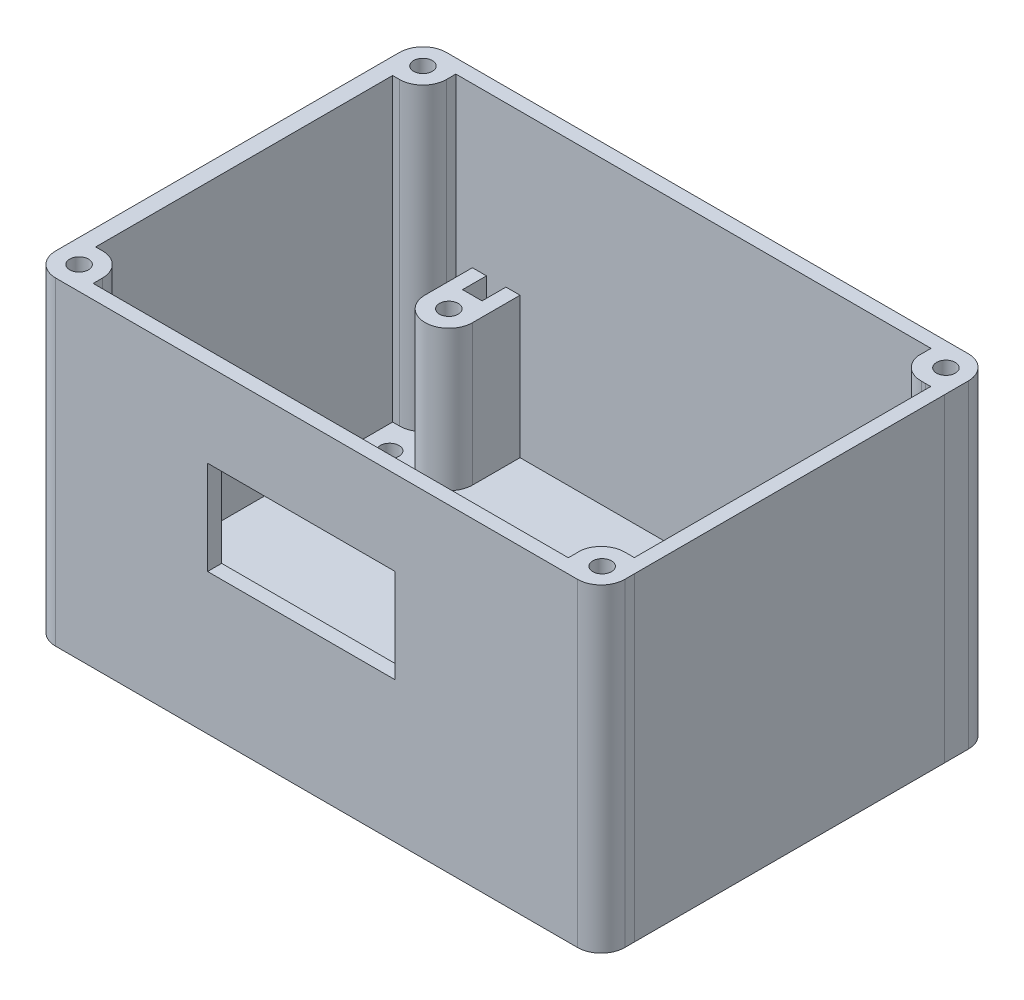
from build123d import *

# Parameters (mm, degrees)
BOSS_EXTRUDE2_DEPTH  = 32
SKETCH1_5_R          = 1
BOSS_EXTRUDE3_DEPTH  = 15
SKETCH3_W            = 59.66
SKETCH3_H            = 41.66
BOSS_EXTRUDE12_DEPTH = 2
SKETCH4_W            = 38.735
SKETCH4_H            = 2
CUT_EXTRUDE1_DEPTH   = 15
SKETCH5_W            = 5
SKETCH5_H            = 2
CUT_EXTRUDE2_DEPTH   = 15
SKETCH6_W            = 2
SKETCH6_H            = 2
CUT_EXTRUDE3_DEPTH   = 15
SKETCH7_W            = 5
SKETCH7_H            = 2
CUT_EXTRUDE4_DEPTH   = 15
SKETCH8_W            = 2
SKETCH8_H            = 2
CUT_EXTRUDE5_DEPTH   = 15
SKETCH9_W            = 38.735
SKETCH9_H            = 2
CUT_EXTRUDE6_DEPTH   = 15
SKETCH10_W           = 20
SKETCH10_H           = 10
CUT_EXTRUDE7_DEPTH   = 15
SKETCH11_W           = 5
SKETCH11_H           = 5
BOSS_EXTRUDE13_DEPTH = 32
CUT_EXTRUDE8_DEPTH   = 10
SKETCH13_W           = 5
SKETCH13_H           = 5
BOSS_EXTRUDE14_DEPTH = 32
SKETCH14_W           = 5
SKETCH14_H           = 5
BOSS_EXTRUDE15_DEPTH = 32
SKETCH15_W           = 5
SKETCH15_H           = 5
BOSS_EXTRUDE16_DEPTH = 32
CUT_EXTRUDE9_DEPTH   = 10
CUT_EXTRUDE10_DEPTH  = 10
CUT_EXTRUDE11_DEPTH  = 10
CUT_EXTRUDE12_DEPTH  = 17
CUT_EXTRUDE13_DEPTH  = 17
CUT_EXTRUDE14_DEPTH  = 47
CUT_EXTRUDE15_DEPTH  = 47
CUT_EXTRUDE16_DEPTH  = 47
CUT_EXTRUDE17_DEPTH  = 47
BOSS_EXTRUDE18_DEPTH = 27
CUT_EXTRUDE19_DEPTH  = 32
CUT_EXTRUDE20_DEPTH  = 32
CUT_EXTRUDE28_DEPTH  = 15
CUT_EXTRUDE29_DEPTH  = 17
BOSS_EXTRUDE24_DEPTH = 15
BOSS_EXTRUDE25_DEPTH = 17
BOSS_EXTRUDE26_DEPTH = 17
SKETCH45_W           = 6
SKETCH45_H           = 43.66
BOSS_EXTRUDE27_DEPTH = 34
SKETCH46_W           = 6
SKETCH46_H           = 2
CUT_EXTRUDE30_DEPTH  = 34
SKETCH47_W           = 2.5
SKETCH47_H           = 0.998333333
CUT_EXTRUDE31_DEPTH  = 17
CUT_EXTRUDE33_DEPTH  = 37
CUT_EXTRUDE34_DEPTH  = 32
BOSS_EXTRUDE28_DEPTH = 34
SKETCH53_W           = 1.000110953
SKETCH53_H           = 33.096
CUT_EXTRUDE35_DEPTH  = 34
SKETCH54_R           = 1
CUT_EXTRUDE36_DEPTH  = 10
SKETCH55_R           = 1.016
CUT_EXTRUDE37_DEPTH  = 10
CUT_EXTRUDE38_DEPTH  = 17
CUT_EXTRUDE41_DEPTH  = 15
CUT_EXTRUDE42_DEPTH  = 15
CUT_EXTRUDE43_DEPTH  = 15
CUT_EXTRUDE44_DEPTH  = 15
SKETCH65_R           = 1.016
BOSS_EXTRUDE29_DEPTH = 15
SKETCH66_R           = 1
CUT_EXTRUDE45_DEPTH  = 10
CUT_EXTRUDE47_DEPTH  = 15
CUT_EXTRUDE48_DEPTH  = 15
CUT_EXTRUDE49_DEPTH  = 15
CUT_EXTRUDE50_DEPTH  = 15
SKETCH72_R           = 1
CUT_EXTRUDE51_DEPTH  = 10
SKETCH73_W           = 50.66
SKETCH73_H           = 0.51
CUT_EXTRUDE52_DEPTH  = 32
SKETCH74_W           = 1.5
SKETCH74_H           = 0.51
BOSS_EXTRUDE30_DEPTH = 15
SKETCH75_W           = 1.5
SKETCH75_H           = 0.51
BOSS_EXTRUDE31_DEPTH = 15
SKETCH76_W           = 1.5
SKETCH76_H           = 0.51
BOSS_EXTRUDE32_DEPTH = 15
SKETCH77_W           = 1.5
SKETCH77_H           = 0.51
BOSS_EXTRUDE33_DEPTH = 15
SKETCH78_W           = 50.66
SKETCH78_H           = 0.5
CUT_EXTRUDE53_DEPTH  = 32
SKETCH79_W           = 1.5
SKETCH79_H           = 0.5
BOSS_EXTRUDE34_DEPTH = 15
SKETCH80_W           = 1.5
SKETCH80_H           = 0.5
BOSS_EXTRUDE35_DEPTH = 15
SKETCH81_W           = 1.5
SKETCH81_H           = 0.5
BOSS_EXTRUDE36_DEPTH = 15
SKETCH82_W           = 1.5
SKETCH82_H           = 0.5
BOSS_EXTRUDE37_DEPTH = 15
CUT_EXTRUDE54_DEPTH  = 32
BOSS_EXTRUDE40_DEPTH = 32
BOSS_EXTRUDE41_DEPTH = 34
SKETCH87_W           = 0.841153112
SKETCH87_H           = 0.19310663
BOSS_EXTRUDE42_DEPTH = 2
SKETCH88_W           = 1.922760296
SKETCH88_H           = 1.416
BOSS_EXTRUDE44_DEPTH = 17
BOSS_EXTRUDE46_DEPTH = 17
BOSS_EXTRUDE47_DEPTH = 17


with BuildPart() as part:
    # Sketch1 → Boss-Extrude2 (new body)
    with BuildSketch(Plane(origin=(0, 0, 0), x_dir=(1, 0, 0), z_dir=(0, 1, 0))):
        Polygon((50.355, -6.54), (50.355, -4.54), (50.355, 35.12), (-9.305, 35.12), (-9.305, -6.54), align=None)
        Polygon((48.355, 31.115), (48.355, -2.54), (48.355, -4.54), (-7.54, -4.54), (-7.54, -2.54), (-7.54, 31.115), (-7.54, 33.115), (48.355, 33.115), align=None, mode=Mode.SUBTRACT)
    extrude(amount=BOSS_EXTRUDE2_DEPTH)

    # Sketch1<5> → Boss-Extrude3 (add)
    # profile 1 of 2: a face of its own
    with BuildSketch(Plane(origin=(0, 0, 0), x_dir=(1, 0, 0), z_dir=(0, 1, 0))):
        Polygon((46.355, 2.54), (41.275, 2.54), (41.275, -2.54), (2.54, -2.54), (2.54, 2.54), (-2.54, 2.54), (-2.54, -2.54), (-7.54, -2.54), (-7.54, -4.54), (48.355, -4.54), (48.355, -2.54), (46.355, -2.54), align=None)
        with Locations((43.815, 0)):
            Circle(SKETCH1_5_R, mode=Mode.SUBTRACT)
        Circle(SKETCH1_5_R, mode=Mode.SUBTRACT)
    # profile 2 of 2: a face of its own
    with BuildSketch(Plane(origin=(0, 0, 0), x_dir=(1, 0, 0), z_dir=(0, 1, 0))):
        Polygon((41.275, 26.035), (46.355, 26.035), (46.355, 31.115), (48.355, 31.115), (48.355, 33.115), (-7.54, 33.115), (-7.54, 31.115), (-2.54, 31.115), (-2.54, 26.035), (2.54, 26.035), (2.54, 31.115), (41.275, 31.115), align=None)
        with Locations((43.815, 28.575)):
            Circle(SKETCH1_5_R, mode=Mode.SUBTRACT)
        with Locations((0, 28.575)):
            Circle(SKETCH1_5_R, mode=Mode.SUBTRACT)
    extrude(amount=BOSS_EXTRUDE3_DEPTH)

    # Sketch3 → Boss-Extrude12 (add)
    with BuildSketch(Plane(origin=(0, 0, 0), x_dir=(-1, 0, 0), z_dir=(0, -1, 0))):
        with Locations((-20.525, 14.29)):
            Rectangle(SKETCH3_W, SKETCH3_H)
    extrude(amount=BOSS_EXTRUDE12_DEPTH)

    # Sketch4 → Cut-Extrude1 (cut)
    with BuildSketch(Plane(origin=(0, 15, 0), x_dir=(1, 0, 0), z_dir=(0, 1, 0))):
        with Locations((21.9075, 32.115)):
            Rectangle(SKETCH4_W, SKETCH4_H)
    extrude(amount=-CUT_EXTRUDE1_DEPTH, mode=Mode.SUBTRACT)

    # Sketch5 → Cut-Extrude2 (cut)
    with BuildSketch(Plane(origin=(0, 15, 0), x_dir=(1, 0, 0), z_dir=(0, 1, 0))):
        with Locations((-5.04, 32.115)):
            Rectangle(SKETCH5_W, SKETCH5_H)
    extrude(amount=-CUT_EXTRUDE2_DEPTH, mode=Mode.SUBTRACT)

    # Sketch6 → Cut-Extrude3 (cut)
    with BuildSketch(Plane(origin=(0, 15, 0), x_dir=(1, 0, 0), z_dir=(0, 1, 0))):
        with Locations((47.355, 32.115)):
            Rectangle(SKETCH6_W, SKETCH6_H)
    extrude(amount=-CUT_EXTRUDE3_DEPTH, mode=Mode.SUBTRACT)

    # Sketch7 → Cut-Extrude4 (cut)
    with BuildSketch(Plane(origin=(0, 15, 0), x_dir=(1, 0, 0), z_dir=(0, 1, 0))):
        with Locations((-5.04, -3.54)):
            Rectangle(SKETCH7_W, SKETCH7_H)
    extrude(amount=-CUT_EXTRUDE4_DEPTH, mode=Mode.SUBTRACT)

    # Sketch8 → Cut-Extrude5 (cut)
    with BuildSketch(Plane(origin=(0, 15, 0), x_dir=(1, 0, 0), z_dir=(0, 1, 0))):
        with Locations((47.355, -3.54)):
            Rectangle(SKETCH8_W, SKETCH8_H)
    extrude(amount=-CUT_EXTRUDE5_DEPTH, mode=Mode.SUBTRACT)

    # Sketch9 → Cut-Extrude6 (cut)
    with BuildSketch(Plane(origin=(0, 15, 0), x_dir=(1, 0, 0), z_dir=(0, 1, 0))):
        with Locations((21.9075, -3.54)):
            Rectangle(SKETCH9_W, SKETCH9_H)
    extrude(amount=-CUT_EXTRUDE6_DEPTH, mode=Mode.SUBTRACT)

    # Sketch10 → Cut-Extrude7 (cut)
    with BuildSketch(Plane.XY.offset(6.54)):
        with Locations((19.395, 18)):
            Rectangle(SKETCH10_W, SKETCH10_H)
    extrude(amount=-CUT_EXTRUDE7_DEPTH, mode=Mode.SUBTRACT)

    # Sketch11 → Boss-Extrude13 (add)
    with BuildSketch(Plane(origin=(0, 32, 0), x_dir=(1, 0, 0), z_dir=(0, 1, 0))):
        with Locations((-6.805, 32.62)):
            Rectangle(SKETCH11_W, SKETCH11_H)
    extrude(amount=-BOSS_EXTRUDE13_DEPTH)

    # Sketch12 → Cut-Extrude8 (cut)
    with BuildSketch(Plane(origin=(0, 32, 0), x_dir=(1, 0, 0), z_dir=(0, 1, 0))):
        with BuildLine():
            ThreePointArc((-7.805, 32.62), (-6.805, 31.62), (-5.805, 32.62))
            ThreePointArc((-5.805, 32.62), (-6.805, 33.62), (-7.805, 32.62))
        make_face()
    extrude(amount=-CUT_EXTRUDE8_DEPTH, mode=Mode.SUBTRACT)

    # Sketch13 → Boss-Extrude14 (add)
    with BuildSketch(Plane(origin=(0, 32, 0), x_dir=(1, 0, 0), z_dir=(0, 1, 0))):
        with Locations((-6.805, -4.04)):
            Rectangle(SKETCH13_W, SKETCH13_H)
    extrude(amount=-BOSS_EXTRUDE14_DEPTH)

    # Sketch14 → Boss-Extrude15 (add)
    with BuildSketch(Plane(origin=(0, 32, 0), x_dir=(1, 0, 0), z_dir=(0, 1, 0))):
        with Locations((47.855, 32.62)):
            Rectangle(SKETCH14_W, SKETCH14_H)
    extrude(amount=-BOSS_EXTRUDE15_DEPTH)

    # Sketch15 → Boss-Extrude16 (add)
    with BuildSketch(Plane(origin=(0, 32, 0), x_dir=(1, 0, 0), z_dir=(0, 1, 0))):
        with Locations((47.855, -4.04)):
            Rectangle(SKETCH15_W, SKETCH15_H)
    extrude(amount=-BOSS_EXTRUDE16_DEPTH)

    # Sketch16 → Cut-Extrude9 (cut)
    with BuildSketch(Plane(origin=(0, 32, 0), x_dir=(1, 0, 0), z_dir=(0, 1, 0))):
        with BuildLine():
            ThreePointArc((47.855, 33.632), (47.139407937, 31.904407937), (48.867, 32.62))
            ThreePointArc((48.867, 32.62), (48.570592063, 33.335592063), (47.855, 33.632))
        make_face()
    extrude(amount=-CUT_EXTRUDE9_DEPTH, mode=Mode.SUBTRACT)

    # Sketch17 → Cut-Extrude10 (cut)
    with BuildSketch(Plane(origin=(0, 32, 0), x_dir=(1, 0, 0), z_dir=(0, 1, 0))):
        with BuildLine():
            ThreePointArc((47.855, -5.052), (48.570592063, -4.755592063), (48.867, -4.04))
            ThreePointArc((48.867, -4.04), (47.139407937, -3.324407937), (47.855, -5.052))
        make_face()
    extrude(amount=-CUT_EXTRUDE10_DEPTH, mode=Mode.SUBTRACT)

    # Sketch18 → Cut-Extrude11 (cut)
    with BuildSketch(Plane(origin=(0, 32, 0), x_dir=(1, 0, 0), z_dir=(0, 1, 0))):
        with BuildLine():
            ThreePointArc((-7.805, -4.04), (-6.805, -5.04), (-5.805, -4.04))
            ThreePointArc((-5.805, -4.04), (-6.805, -3.04), (-7.805, -4.04))
        make_face()
    extrude(amount=-CUT_EXTRUDE11_DEPTH, mode=Mode.SUBTRACT)

    # Sketch19 → Cut-Extrude12 (cut)
    with BuildSketch(Plane(origin=(0, 32, 0), x_dir=(1, 0, 0), z_dir=(0, 1, 0))):
        Polygon((45.355, 33.115), (48.355, 30.12), (45.355, 30.12), align=None)
    extrude(amount=-CUT_EXTRUDE12_DEPTH, mode=Mode.SUBTRACT)

    # Sketch20 → Cut-Extrude13 (cut)
    with BuildSketch(Plane(origin=(0, 32, 0), x_dir=(1, 0, 0), z_dir=(0, 1, 0))):
        Polygon((45.355, -4.54), (48.355, -1.54), (45.355, -1.54), align=None)
    extrude(amount=-CUT_EXTRUDE13_DEPTH, mode=Mode.SUBTRACT)

    # Sketch23 → Cut-Extrude14 (cut)
    with BuildSketch(Plane(origin=(0, 32, 0), x_dir=(1, 0, 0), z_dir=(0, 1, 0))):
        with BuildLine():
            Line((50.355, 32.62), (50.355, 35.12))
            Line((50.355, 35.12), (47.855, 35.12))
            ThreePointArc((47.855, 35.12), (49.622766953, 34.387766953), (50.355, 32.62))
        make_face()
    extrude(amount=-CUT_EXTRUDE14_DEPTH, mode=Mode.SUBTRACT)

    # Sketch24 → Cut-Extrude15 (cut)
    with BuildSketch(Plane(origin=(0, 32, 0), x_dir=(1, 0, 0), z_dir=(0, 1, 0))):
        with BuildLine():
            Line((47.855, -6.54), (50.355, -6.54))
            Line((50.355, -6.54), (50.355, -4.04))
            ThreePointArc((50.355, -4.04), (49.622766953, -5.807766953), (47.855, -6.54))
        make_face()
    extrude(amount=-CUT_EXTRUDE15_DEPTH, mode=Mode.SUBTRACT)

    # Sketch25 → Cut-Extrude16 (cut)
    with BuildSketch(Plane(origin=(0, 32, 0), x_dir=(1, 0, 0), z_dir=(0, 1, 0))):
        with BuildLine():
            Line((-9.305, -4.040000032), (-9.305, -6.54))
            Line((-9.305, -6.54), (-6.805, -6.54))
            ThreePointArc((-6.805, -6.54), (-8.572766942, -5.807766964), (-9.305, -4.040000032))
        make_face()
    extrude(amount=-CUT_EXTRUDE16_DEPTH, mode=Mode.SUBTRACT)

    # Sketch26 → Cut-Extrude17 (cut)
    with BuildSketch(Plane(origin=(0, 32, 0), x_dir=(1, 0, 0), z_dir=(0, 1, 0))):
        with BuildLine():
            Line((-6.805, 35.12), (-9.305, 35.12))
            Line((-9.305, 35.12), (-9.305, 32.62))
            ThreePointArc((-9.305, 32.62), (-8.572766953, 34.387766953), (-6.805, 35.12))
        make_face()
    extrude(amount=-CUT_EXTRUDE17_DEPTH, mode=Mode.SUBTRACT)

    # Sketch27 → Boss-Extrude18 (add)
    with BuildSketch(Plane(origin=(0, 32, 0), x_dir=(1, 0, 0), z_dir=(0, 1, 0))):
        with BuildLine():
            Line((45.397262026, -4.497737974), (48.312737974, -1.582262026))
            ThreePointArc((48.312737974, -1.582262026), (46.087233047, -2.272233047), (45.397262026, -4.497737974))
        make_face()
    extrude(amount=-BOSS_EXTRUDE18_DEPTH)

    # Sketch28 → Cut-Extrude19 (cut)
    with BuildSketch(Plane(origin=(0, 32, 0), x_dir=(1, 0, 0), z_dir=(0, 1, 0))):
        with BuildLine():
            Line((-4.305, -4.04), (-4.305, -1.54))
            Line((-4.305, -1.54), (-6.805, -1.54))
            ThreePointArc((-6.805, -1.54), (-5.037233047, -2.272233047), (-4.305, -4.04))
        make_face()
    extrude(amount=-CUT_EXTRUDE19_DEPTH, mode=Mode.SUBTRACT)

    # Sketch29 → Cut-Extrude20 (cut)
    with BuildSketch(Plane(origin=(0, 32, 0), x_dir=(1, 0, 0), z_dir=(0, 1, 0))):
        with BuildLine():
            Line((-6.805, 30.12), (-4.305, 30.12))
            Line((-4.305, 30.12), (-4.305, 32.62))
            ThreePointArc((-4.305, 32.62), (-5.037233047, 30.852233047), (-6.805, 30.12))
        make_face()
    extrude(amount=-CUT_EXTRUDE20_DEPTH, mode=Mode.SUBTRACT)

    # Sketch40 → Cut-Extrude28 (cut)
    with BuildSketch(Plane(origin=(0, 15, 0), x_dir=(1, 0, 0), z_dir=(0, 1, 0))):
        Polygon((46.355, -1.54), (46.355, -2.067390795), (48.355, -1.54), align=None)
    extrude(amount=-CUT_EXTRUDE28_DEPTH, mode=Mode.SUBTRACT)

    # Sketch41 → Cut-Extrude29 (cut)
    with BuildSketch(Plane(origin=(0, 32, 0), x_dir=(1, 0, 0), z_dir=(0, 1, 0))):
        with BuildLine():
            Line((45.355, 0), (45.355, -4.04))
            ThreePointArc((45.355, -4.04), (45.365587927, -4.269842409), (45.397262026, -4.497737974))
            Line((45.397262026, -4.497737974), (48.355, -1.54))
            Line((48.355, -1.54), (48.355, 0))
            Line((48.355, 0), (45.355, 0))
        make_face()
    extrude(amount=-CUT_EXTRUDE29_DEPTH, mode=Mode.SUBTRACT)

    # Sketch42 → Boss-Extrude24 (add)
    with BuildSketch(Plane(origin=(0, 15, 0), x_dir=(1, 0, 0), z_dir=(0, 1, 0))):
        Polygon((48.355, -1.54), (46.355, -1.54), (46.355, -2.067390795), align=None)
    extrude(amount=-BOSS_EXTRUDE24_DEPTH)

    # Sketch43 → Boss-Extrude25 (add)
    with BuildSketch(Plane(origin=(0, 15, 0), x_dir=(1, 0, 0), z_dir=(0, 1, 0))):
        Polygon((48.355, 30.12), (46.355, 30.12), (46.355, 32.116666667), align=None)
    extrude(amount=BOSS_EXTRUDE25_DEPTH)

    # Sketch44 → Boss-Extrude26 (add)
    with BuildSketch(Plane(origin=(0, 32, 0), x_dir=(1, 0, 0), z_dir=(0, 1, 0))):
        Polygon((46.355, 32.116666667), (43.855, 32.116666667), (43.855, 33.115), (45.355, 33.115), align=None)
    extrude(amount=-BOSS_EXTRUDE26_DEPTH)

    # Sketch45 → Boss-Extrude27 (add)
    with BuildSketch(Plane(origin=(0, 32, 0), x_dir=(1, 0, 0), z_dir=(0, 1, 0))):
        with Locations((49.355, 15.29)):
            Rectangle(SKETCH45_W, SKETCH45_H)
    extrude(amount=-BOSS_EXTRUDE27_DEPTH)

    # Sketch46 → Cut-Extrude30 (cut)
    with BuildSketch(Plane(origin=(0, 32, 0), x_dir=(1, 0, 0), z_dir=(0, 1, 0))):
        with Locations((49.355, 36.12)):
            Rectangle(SKETCH46_W, SKETCH46_H)
    extrude(amount=-CUT_EXTRUDE30_DEPTH, mode=Mode.SUBTRACT)

    # Sketch47 → Cut-Extrude31 (cut)
    with BuildSketch(Plane(origin=(0, 32, 0), x_dir=(1, 0, 0), z_dir=(0, 1, 0))):
        with Locations((45.105, 32.615833334)):
            Rectangle(SKETCH47_W, SKETCH47_H)
    extrude(amount=-CUT_EXTRUDE31_DEPTH, mode=Mode.SUBTRACT)

    # Sketch48 → Cut-Extrude33 (cut)
    with BuildSketch(Plane(origin=(0, 32, 0), x_dir=(1, 0, 0), z_dir=(0, 1, 0))):
        with BuildLine():
            Line((52.355, 30.088), (52.355, 35.12))
            Line((52.355, 35.12), (48.835, 35.12))
            ThreePointArc((48.835, 35.12), (51.351, 32.604), (48.835, 30.088))
            Line((48.835, 30.088), (52.355, 30.088))
        make_face()
        with BuildLine():
            Line((52.355, -6.54), (52.355, -3.008))
            Line((52.355, -3.008), (51.140738473, -3.008))
            ThreePointArc((51.140738473, -3.008), (50.946903224, -5.397681186), (48.839, -6.54))
            Line((48.839, -6.54), (52.355, -6.54))
        make_face()
    extrude(amount=-CUT_EXTRUDE33_DEPTH, mode=Mode.SUBTRACT)

    # Sketch48<5> → Cut-Extrude34 (cut)
    with BuildSketch(Plane(origin=(0, 32, 0), x_dir=(1, 0, 0), z_dir=(0, 1, 0))):
        with BuildLine():
            Line((50.355, 30.088), (48.835, 30.088))
            ThreePointArc((48.835, 30.088), (47.212773957, 30.680815488), (46.355, 32.179905671))
            Line((46.355, 32.179905671), (46.355, -3.54))
            Line((46.355, -3.54), (46.355, -3.624))
            ThreePointArc((46.355, -3.624), (47.207458398, -2.108712032), (48.839, -1.508))
            Line((48.839, -1.508), (50.355, -1.508))
            Line((50.355, -1.508), (50.355, 30.088))
        make_face()
    extrude(amount=-CUT_EXTRUDE34_DEPTH, mode=Mode.SUBTRACT)

    # Sketch52 → Boss-Extrude28 (add)
    with BuildSketch(Plane(origin=(0, 32, 0), x_dir=(1, 0, 0), z_dir=(0, 1, 0))):
        Polygon((51.355, -4.024), (51.351, 32.604), (49.351, 32.604), (49.022347414, -4.024), align=None)
    extrude(amount=-BOSS_EXTRUDE28_DEPTH)

    # Sketch53 → Cut-Extrude35 (cut)
    with BuildSketch(Plane(origin=(0, 32, 0), x_dir=(1, 0, 0), z_dir=(0, 1, 0))):
        with Locations((51.854944524, 13.54)):
            Rectangle(SKETCH53_W, SKETCH53_H)
    extrude(amount=-CUT_EXTRUDE35_DEPTH, mode=Mode.SUBTRACT)

    # Sketch54 → Cut-Extrude36 (cut)
    with BuildSketch(Plane(origin=(0, 32, 0), x_dir=(1, 0, 0), z_dir=(0, 1, 0))):
        with Locations((48.941961382, -4.023999992)):
            Circle(SKETCH54_R)
    extrude(amount=-CUT_EXTRUDE36_DEPTH, mode=Mode.SUBTRACT)

    # Sketch55 → Cut-Extrude37 (cut)
    with BuildSketch(Plane(origin=(0, 32, 0), x_dir=(1, 0, 0), z_dir=(0, 1, 0))):
        with Locations((49.328863831, 32.555053813)):
            Circle(SKETCH55_R)
    extrude(amount=-CUT_EXTRUDE37_DEPTH, mode=Mode.SUBTRACT)

    # Sketch56 → Cut-Extrude38 (cut)
    with BuildSketch(Plane(origin=(0, 32, 0), x_dir=(1, 0, 0), z_dir=(0, 1, 0))):
        Polygon((46.355, -3.54), (45.355, -4.54), (46.355, -4.54), (46.355, -3.624), align=None)
    extrude(amount=-CUT_EXTRUDE38_DEPTH, mode=Mode.SUBTRACT)

    # Sketch61 → Cut-Extrude41 (cut)
    with BuildSketch(Plane(origin=(0, 15, 0), x_dir=(1, 0, 0), z_dir=(0, 1, 0))):
        Polygon((-1.04, 33.115), (-1.04, 31.075), (0, 31.075), (1.04, 31.075), (1.04, 33.115), align=None)
    extrude(amount=-CUT_EXTRUDE41_DEPTH, mode=Mode.SUBTRACT)

    # Sketch62 → Cut-Extrude42 (cut)
    with BuildSketch(Plane(origin=(0, 15, 0), x_dir=(1, 0, 0), z_dir=(0, 1, 0))):
        Polygon((42.775, 31.075), (43.815, 31.075), (44.855, 31.075), (44.855, 33.115), (42.775, 33.115), align=None)
    extrude(amount=-CUT_EXTRUDE42_DEPTH, mode=Mode.SUBTRACT)

    # Sketch63 → Cut-Extrude43 (cut)
    with BuildSketch(Plane(origin=(0, 15, 0), x_dir=(1, 0, 0), z_dir=(0, 1, 0))):
        Polygon((1.04, -2.5), (0, -2.5), (-1.04, -2.5), (-1.04, -4.54), (1.04, -4.54), align=None)
    extrude(amount=-CUT_EXTRUDE43_DEPTH, mode=Mode.SUBTRACT)

    # Sketch64 → Cut-Extrude44 (cut)
    with BuildSketch(Plane(origin=(0, 15, 0), x_dir=(1, 0, 0), z_dir=(0, 1, 0))):
        Polygon((44.855, -2.5), (43.815, -2.5), (42.775, -2.5), (42.775, -4.54), (44.855, -4.54), align=None)
    extrude(amount=-CUT_EXTRUDE44_DEPTH, mode=Mode.SUBTRACT)

    # Sketch65 → Boss-Extrude29 (add)
    with BuildSketch(Plane(origin=(0, 32, 0), x_dir=(1, 0, 0), z_dir=(0, 1, 0))):
        with Locations((49.328863831, 32.555053813)):
            Circle(SKETCH65_R)
    extrude(amount=-BOSS_EXTRUDE29_DEPTH)

    # Sketch66 → Cut-Extrude45 (cut)
    with BuildSketch(Plane(origin=(0, 32, 0), x_dir=(1, 0, 0), z_dir=(0, 1, 0))):
        with Locations((48.941961382, 32.632000008)):
            Circle(SKETCH66_R)
    extrude(amount=-CUT_EXTRUDE45_DEPTH, mode=Mode.SUBTRACT)

    # Sketch67 → Cut-Extrude47 (cut)
    with BuildSketch(Plane(origin=(0, 15, 0), x_dir=(1, 0, 0), z_dir=(0, 1, 0))):
        with BuildLine():
            ThreePointArc((43.815, 26.035), (42.018948776, 26.778948776), (41.275, 28.575))
            Line((41.275, 28.575), (41.275, 26.035))
            Line((41.275, 26.035), (43.815, 26.035))
        make_face()
        with BuildLine():
            Line((46.355, 26.035), (46.355, 28.575))
            ThreePointArc((46.355, 28.575), (45.611051224, 26.778948776), (43.815, 26.035))
            Line((43.815, 26.035), (46.355, 26.035))
        make_face()
    extrude(amount=-CUT_EXTRUDE47_DEPTH, mode=Mode.SUBTRACT)

    # Sketch69 → Cut-Extrude48 (cut)
    with BuildSketch(Plane(origin=(0, 15, 0), x_dir=(1, 0, 0), z_dir=(0, 1, 0))):
        with BuildLine():
            ThreePointArc((0, 26.035), (-1.796051224, 26.778948776), (-2.54, 28.575))
            Line((-2.54, 28.575), (-2.54, 26.035))
            Line((-2.54, 26.035), (0, 26.035))
        make_face()
        with BuildLine():
            Line((2.54, 26.035), (2.54, 28.575))
            ThreePointArc((2.54, 28.575), (1.796051224, 26.778948776), (0, 26.035))
            Line((0, 26.035), (2.54, 26.035))
        make_face()
    extrude(amount=-CUT_EXTRUDE48_DEPTH, mode=Mode.SUBTRACT)

    # Sketch70 → Cut-Extrude49 (cut)
    with BuildSketch(Plane(origin=(0, 15, 0), x_dir=(1, 0, 0), z_dir=(0, 1, 0))):
        with BuildLine():
            ThreePointArc((-2.54, 0), (-1.796051224, 1.796051224), (0, 2.54))
            Line((0, 2.54), (-2.54, 2.54))
            Line((-2.54, 2.54), (-2.54, 0))
        make_face()
        with BuildLine():
            Line((2.54, 2.54), (0, 2.54))
            ThreePointArc((0, 2.54), (1.796051224, 1.796051224), (2.54, 0))
            Line((2.54, 0), (2.54, 2.54))
        make_face()
    extrude(amount=-CUT_EXTRUDE49_DEPTH, mode=Mode.SUBTRACT)

    # Sketch71 → Cut-Extrude50 (cut)
    with BuildSketch(Plane(origin=(0, 15, 0), x_dir=(1, 0, 0), z_dir=(0, 1, 0))):
        with BuildLine():
            ThreePointArc((43.815, 2.54), (45.611051224, 1.796051224), (46.355, 0))
            Line((46.355, 0), (46.355, 2.54))
            Line((46.355, 2.54), (43.815, 2.54))
        make_face()
        with BuildLine():
            ThreePointArc((41.275, 0), (42.018948776, 1.796051224), (43.815, 2.54))
            Line((43.815, 2.54), (41.275, 2.54))
            Line((41.275, 2.54), (41.275, 0))
        make_face()
    extrude(amount=-CUT_EXTRUDE50_DEPTH, mode=Mode.SUBTRACT)

    # Sketch72 → Cut-Extrude51 (cut)
    with BuildSketch(Plane(origin=(0, 0, 0), x_dir=(1, 0, 0), z_dir=(0, 1, 0))):
        with Locations((47.823529119, 27.305)):
            Circle(SKETCH72_R)
        with Locations((47.718122156, 1.27)):
            Circle(SKETCH72_R)
        with Locations((-5.04, 1.27)):
            Circle(SKETCH72_R)
        with Locations((-5.04, 27.305)):
            Circle(SKETCH72_R)
    extrude(amount=-CUT_EXTRUDE51_DEPTH, mode=Mode.SUBTRACT)

    # Sketch73 → Cut-Extrude52 (cut)
    with BuildSketch(Plane(origin=(0, 32, 0), x_dir=(1, 0, 0), z_dir=(0, 1, 0))):
        with Locations((21.025, 33.37)):
            Rectangle(SKETCH73_W, SKETCH73_H)
    extrude(amount=-CUT_EXTRUDE52_DEPTH, mode=Mode.SUBTRACT)

    # Sketch74 → Boss-Extrude30 (add)
    with BuildSketch(Plane(origin=(0, 0, 0), x_dir=(1, 0, 0), z_dir=(0, 1, 0))):
        with Locations((42.025, 33.37)):
            Rectangle(SKETCH74_W, SKETCH74_H)
    extrude(amount=BOSS_EXTRUDE30_DEPTH)

    # Sketch75 → Boss-Extrude31 (add)
    with BuildSketch(Plane(origin=(0, 0, 0), x_dir=(1, 0, 0), z_dir=(0, 1, 0))):
        with Locations((45.605, 33.37)):
            Rectangle(SKETCH75_W, SKETCH75_H)
    extrude(amount=BOSS_EXTRUDE31_DEPTH)

    # Sketch76 → Boss-Extrude32 (add)
    with BuildSketch(Plane(origin=(0, 0, 0), x_dir=(1, 0, 0), z_dir=(0, 1, 0))):
        with Locations((-1.79, 33.37)):
            Rectangle(SKETCH76_W, SKETCH76_H)
    extrude(amount=BOSS_EXTRUDE32_DEPTH)

    # Sketch77 → Boss-Extrude33 (add)
    with BuildSketch(Plane(origin=(0, 0, 0), x_dir=(1, 0, 0), z_dir=(0, 1, 0))):
        with Locations((1.79, 33.37)):
            Rectangle(SKETCH77_W, SKETCH77_H)
    extrude(amount=BOSS_EXTRUDE33_DEPTH)

    # Sketch78 → Cut-Extrude53 (cut)
    with BuildSketch(Plane(origin=(0, 32, 0), x_dir=(1, 0, 0), z_dir=(0, 1, 0))):
        with Locations((21.025, -4.79)):
            Rectangle(SKETCH78_W, SKETCH78_H)
    extrude(amount=-CUT_EXTRUDE53_DEPTH, mode=Mode.SUBTRACT)

    # Sketch79 → Boss-Extrude34 (add)
    with BuildSketch(Plane(origin=(0, 0, 0), x_dir=(1, 0, 0), z_dir=(0, 1, 0))):
        with Locations((1.79, -4.79)):
            Rectangle(SKETCH79_W, SKETCH79_H)
    extrude(amount=BOSS_EXTRUDE34_DEPTH)

    # Sketch80 → Boss-Extrude35 (add)
    with BuildSketch(Plane(origin=(0, 0, 0), x_dir=(1, 0, 0), z_dir=(0, 1, 0))):
        with Locations((-1.79, -4.79)):
            Rectangle(SKETCH80_W, SKETCH80_H)
    extrude(amount=BOSS_EXTRUDE35_DEPTH)

    # Sketch81 → Boss-Extrude36 (add)
    with BuildSketch(Plane(origin=(0, 0, 0), x_dir=(1, 0, 0), z_dir=(0, 1, 0))):
        with Locations((45.605, -4.79)):
            Rectangle(SKETCH81_W, SKETCH81_H)
    extrude(amount=BOSS_EXTRUDE36_DEPTH)

    # Sketch82 → Boss-Extrude37 (add)
    with BuildSketch(Plane(origin=(0, 0, 0), x_dir=(1, 0, 0), z_dir=(0, 1, 0))):
        with Locations((42.025, -4.79)):
            Rectangle(SKETCH82_W, SKETCH82_H)
    extrude(amount=BOSS_EXTRUDE37_DEPTH)

    # Sketch83 → Cut-Extrude54 (cut)
    with BuildSketch(Plane(origin=(0, 32, 0), x_dir=(1, 0, 0), z_dir=(0, 1, 0))):
        Polygon((49.328863831, 30.136946187), (49.044922763, -1.508), (49.858863831, -1.508), (49.858863831, 30.136946187), align=None)
    extrude(amount=-CUT_EXTRUDE54_DEPTH, mode=Mode.SUBTRACT)

    # Sketch84 → Boss-Extrude40 (add)
    with BuildSketch(Plane(origin=(0, 0, 0), x_dir=(1, 0, 0), z_dir=(0, 1, 0))):
        Polygon((49.328863831, 30.136946187), (49.32842465, 30.088), (49.858863831, 30.088), (49.858863831, 30.136946187), align=None)
    extrude(amount=BOSS_EXTRUDE40_DEPTH)

    # Sketch86 → Boss-Extrude41 (add)
    with BuildSketch(Plane(origin=(0, 32, 0), x_dir=(1, 0, 0), z_dir=(0, 1, 0))):
        Polygon((49.32842465, 30.088), (48.757072058, 30.089207119), (49.328863831, 30.136946187), align=None)
    extrude(amount=-BOSS_EXTRUDE41_DEPTH)

    # Sketch87 → Boss-Extrude42 (add)
    with BuildSketch(Plane.XZ.offset(2)):
        with Locations((49.052378163, -30.0974859)):
            Rectangle(SKETCH87_W, SKETCH87_H)
    extrude(amount=-BOSS_EXTRUDE42_DEPTH)

    # Sketch88 → Boss-Extrude44 (add)
    with BuildSketch(Plane(origin=(0, 15, 0), x_dir=(1, 0, 0), z_dir=(0, 1, 0))):
        with Locations((45.816380148, -4.332)):
            Rectangle(SKETCH88_W, SKETCH88_H)
    extrude(amount=-BOSS_EXTRUDE44_DEPTH)

    # Sketch89 → Boss-Extrude46 (add)
    with BuildSketch(Plane(origin=(0, 15, 0), x_dir=(1, 0, 0), z_dir=(0, 1, 0))):
        Polygon((48.880053389, 30.625), (46.355, 32.179905671), (46.355, 30.625), align=None)
    extrude(amount=-BOSS_EXTRUDE46_DEPTH)

    # Sketch90 → Boss-Extrude47 (add)
    with BuildSketch(Plane(origin=(0, 15, 0), x_dir=(1, 0, 0), z_dir=(0, 1, 0))):
        Polygon((46.355, -5.04), (46.355, -2.04), (49.390193167, -2.04), align=None)
    extrude(amount=-BOSS_EXTRUDE47_DEPTH)


solid = part.part
